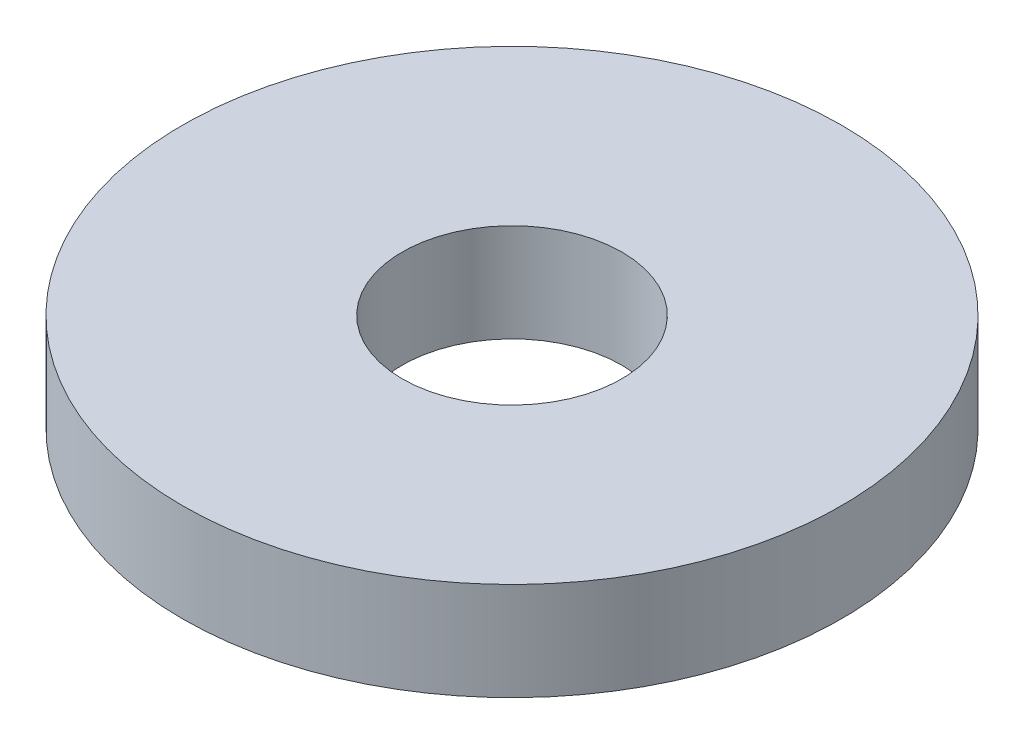
from build123d import *

# Parameters (mm, degrees)
SKETCH1_R           = 97.5
BOSS_EXTRUDE1_DEPTH = 29
SKETCH2_R           = 32.5
CUT_EXTRUDE1_DEPTH  = 141.902448524


with BuildPart() as part:
    # Sketch1 → Boss-Extrude1 (new body)
    with BuildSketch(Plane(origin=(0, 0, 0), x_dir=(1, 0, 0), z_dir=(0, 1, 0))):
        Circle(SKETCH1_R)
    extrude(amount=BOSS_EXTRUDE1_DEPTH)

    # Sketch2 → Cut-Extrude1 (cut, through all)
    with BuildSketch(Plane(origin=(0, 0, 0), x_dir=(1, 0, 0), z_dir=(0, 1, 0))):
        Circle(SKETCH2_R)
    extrude(amount=CUT_EXTRUDE1_DEPTH, mode=Mode.SUBTRACT)


solid = part.part
